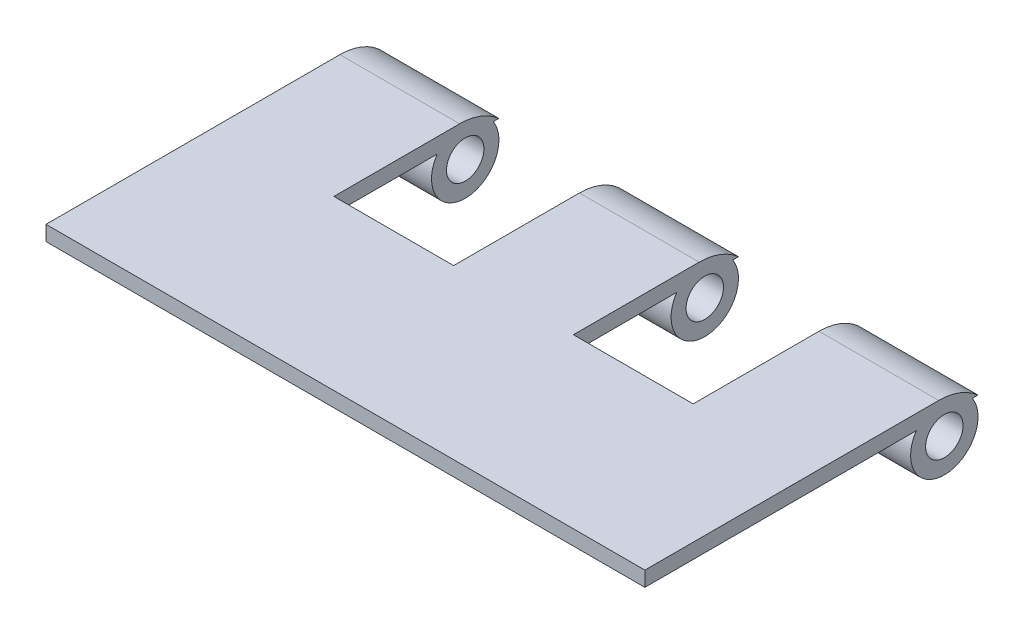
from build123d import *

# Parameters (mm, degrees)
BOSS_EXTRUDE1_DEPTH = 0.635
BOSS_EXTRUDE2_REACH = 31.451
SKETCH2_R           = 1.42875
SKETCH3_W           = 5.08
SKETCH3_H           = 7
CUT_EXTRUDE1_DEPTH  = 40
SKETCH4_R           = 0.79375
CUT_EXTRUDE2_DEPTH  = 40
FILLET1_R           = 2.5


with BuildPart() as part:
    # Sketch1 → Boss-Extrude1 (new body)
    with BuildSketch(Plane(origin=(0, 0, 0), x_dir=(1, 0, 0), z_dir=(0, 1, 0))):
        Polygon((-6.689871172, 14.89260144), (-11.769871172, 14.89260144), (-11.769871172, 0.76385144), (13.630128828, 0.76385144), (13.630128828, 14.89260144), (8.550128828, 14.89260144), (8.550128828, 7.89260144), (3.470128828, 7.89260144), (3.470128828, 14.89260144), (-1.609871172, 14.89260144), (-1.609871172, 7.89260144), (-6.689871172, 7.89260144), align=None)
    extrude(amount=BOSS_EXTRUDE1_DEPTH)

    # Boss-Extrude2: up to this face of the body (flat: up to its plane)
    boss_extrude2_end = Plane(part.part.faces().sort_by_distance((-11.769871172, 0.3175, -7.82822644))[0])
    # Sketch2 → Boss-Extrude2 (add, up to the picked face)
    with BuildSketch(Plane(origin=(13.630128828, 0, 0), x_dir=(0, 0, -1), z_dir=(1, 0, 0)), mode=Mode.PRIVATE) as boss_extrude2_sk1:
        with Locations(Location((13.46385144, -0.79375, 0), (0, 0, 33.748988596))):
            Circle(SKETCH2_R)
    boss_extrude2_tool1 = split(extrude(boss_extrude2_sk1.sketch, amount=-BOSS_EXTRUDE2_REACH, mode=Mode.PRIVATE), bisect_by=boss_extrude2_end, keep=Keep.BOTH, mode=Mode.PRIVATE)
    add(boss_extrude2_tool1.solids().sort_by(Axis((13.630129, -0.79375, -13.463851), (-1, 0, 0)))[0])

    # Sketch3 → Cut-Extrude1 (cut)
    with BuildSketch(Plane(origin=(0, 0.635, 0), x_dir=(1, 0, 0), z_dir=(0, 1, 0))):
        with Locations((-4.149871172, 11.39260144)):
            Rectangle(SKETCH3_W, SKETCH3_H)
        with Locations((6.010128828, 11.39260144)):
            Rectangle(SKETCH3_W, SKETCH3_H)
    extrude(amount=-CUT_EXTRUDE1_DEPTH, mode=Mode.SUBTRACT)

    # Sketch4 → Cut-Extrude2 (cut)
    with BuildSketch(Plane(origin=(13.630128828, 0, 0), x_dir=(0, 0, -1), z_dir=(1, 0, 0))):
        with Locations((13.46385144, -0.79375)):
            Circle(SKETCH4_R)
    extrude(amount=-CUT_EXTRUDE2_DEPTH, mode=Mode.SUBTRACT)

    # Fillet1
    # the kernel refuses this fillet: 2.5 mm, written as the material it takes off along each edge
    with BuildSketch(Plane(origin=(-2.527709024, 0.635, -14.89260144), x_dir=(0, 0, 1), z_dir=(-1, 0, 0)), Plane(origin=(7.632290976, 0.635, -14.89260144), x_dir=(0, 0, 1), z_dir=(-1, 0, 0))) as fillet1_piece_1:
        with BuildLine():
            CenterArc((1.664864859, -2.5), FILLET1_R, 90, 41.754936598)
            Line((0, -0.635), (-0.033297297, -0.5977))
            ThreePointArc((-0.033297297, -0.5977), (-0.05, -0.3175), (-0.05, 0))
            Line((-0.05, 0), (0, 0.05))
            Line((0, 0.05), (1.664864859, 0.05))
            Line((1.664864859, 0.05), (1.664864859, 0))
        make_face()
    extrude(amount=13.404324297, mode=Mode.SUBTRACT)
    with BuildSketch(Plane(origin=(17.792290976, 0.635, -14.89260144), x_dir=(0, -1, 0), z_dir=(-1, 0, 0))) as fillet1_piece_2:
        with BuildLine():
            CenterArc((2.5, 1.664864859), FILLET1_R, 180, 41.754936598)
            Line((0, 1.664864859), (-0.05, 1.664864859))
            Line((-0.05, 1.664864859), (-0.05, 0))
            Line((-0.05, 0), (0, -0.05))
            ThreePointArc((0, -0.05), (0.3175, -0.05), (0.5977, -0.033297297))
            Line((0.5977, -0.033297297), (0.635, 0))
        make_face()
    extrude(amount=13.404324297, mode=Mode.SUBTRACT)


solid = part.part
